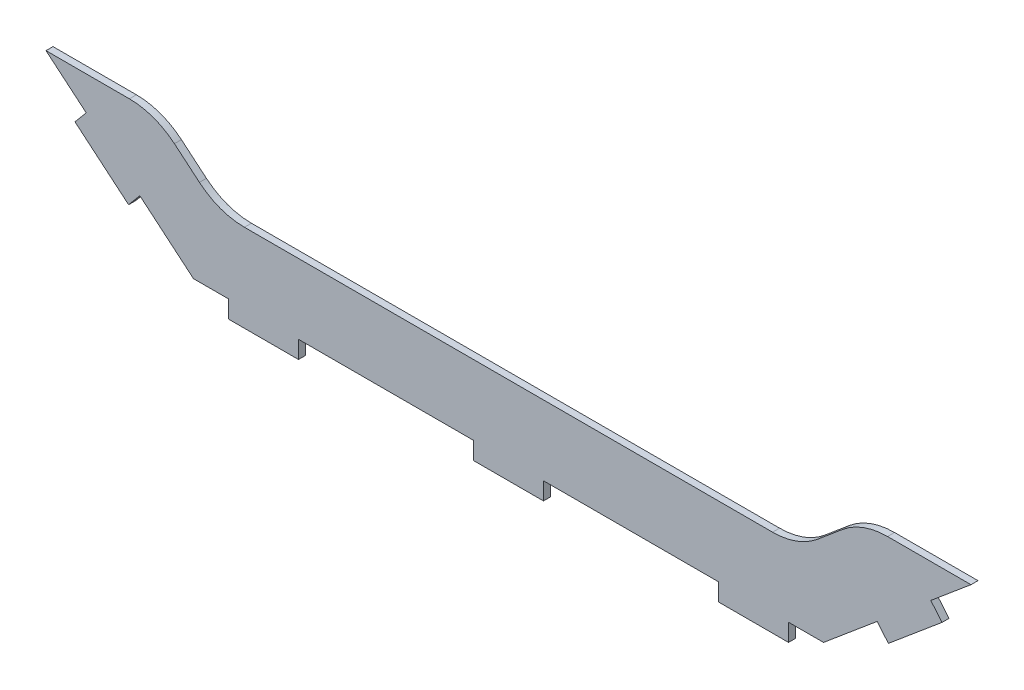
from build123d import *

# Parameters (mm, degrees)
BOSS_EXTRUDE1_DEPTH = 0.05
FILLET1_R           = 1


with BuildPart() as part:
    # frame_outline → Boss-Extrude1 (new, symmetric)
    with BuildSketch(Plane.XY):
        Polygon((0.5, 0), (3, 0), (3, -0.25), (4, -0.25), (4, 0), (4.5, 0), (5.266044443, 0.64278761), (5.426741346, 0.451276499), (6.192785789, 1.094064109), (6.032088886, 1.285575219), (6.606622219, 1.767665927), (5.050898392, 1.767665927), (4.136029766, 1), (-4.136029766, 1), (-5.050898392, 1.767665927), (-6.606622219, 1.767665927), (-6.032088886, 1.285575219), (-6.192785789, 1.094064109), (-5.426741346, 0.451276499), (-5.266044443, 0.64278761), (-4.5, 0), (-4, 0), (-4, -0.25), (-3, -0.25), (-3, 0), (-0.5, 0), (-0.5, -0.25), (0.5, -0.25), align=None)
    extrude(amount=BOSS_EXTRUDE1_DEPTH, both=True)

    # Fillet1
    fillet1_edges = [part.edges().sort_by_distance(p)[0] for p in [
        (4.136029766, 1, 0),
        (5.050898392, 1.767665927, 0),
        (-4.136029766, 1, 0),
        (-5.050898392, 1.767665927, 0),
    ]]
    fillet(fillet1_edges, radius=FILLET1_R)


solid = part.part
